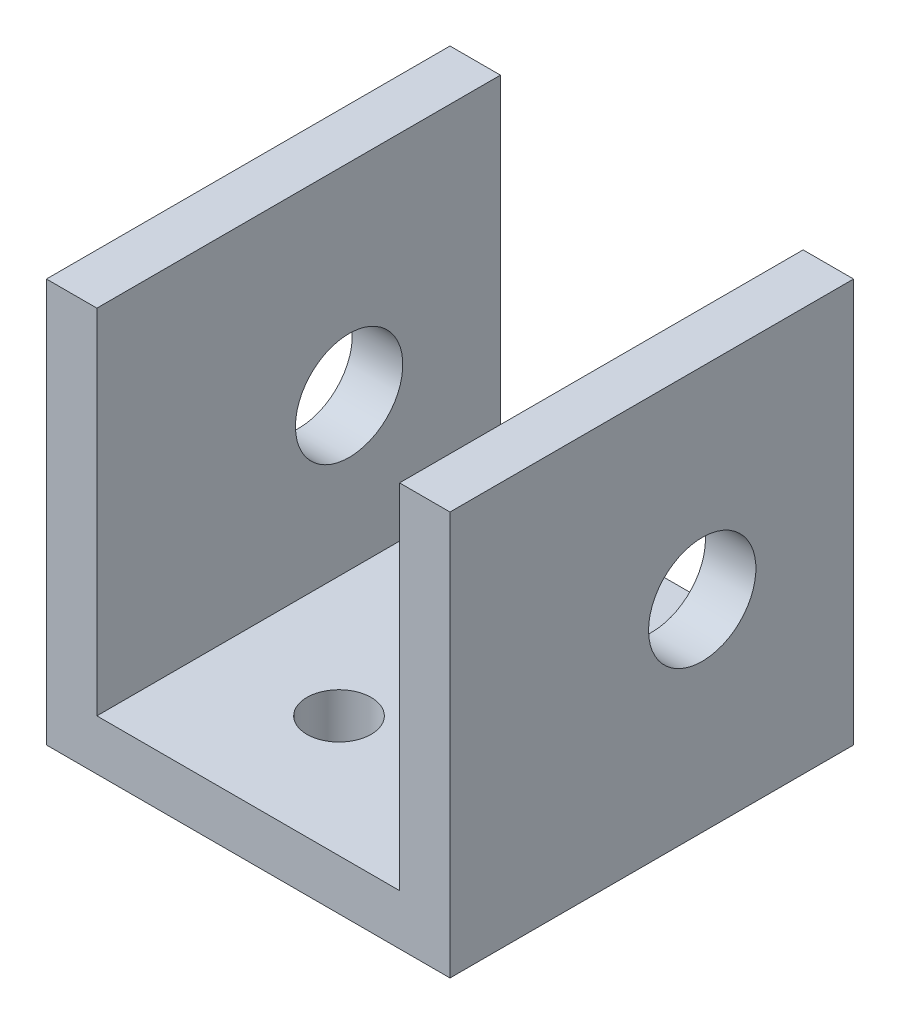
from build123d import *

# Parameters (mm, degrees)
SKETCH1_W               = 25.4
SKETCH1_H               = 25.4
BOSS_EXTRUDE1_DEPTH     = 3.175
SKETCH2_W               = 3.175
SKETCH2_H               = 25.4
BOSS_EXTRUDE2_DEPTH     = 22.225
F_10_32_TAPPED_HOLE1_D  = 4.0386
F_1_4_CLEARANCE_HOLE1_D = 6.7564


with BuildPart() as part:
    # Sketch1 → Boss-Extrude1 (new body)
    with BuildSketch(Plane(origin=(0, 0, 0), x_dir=(1, 0, 0), z_dir=(0, 1, 0))):
        Rectangle(SKETCH1_W, SKETCH1_H)
    extrude(amount=BOSS_EXTRUDE1_DEPTH)

    # Sketch2 → Boss-Extrude2 (add)
    with BuildSketch(Plane(origin=(0, 3.175, 0), x_dir=(1, 0, 0), z_dir=(0, 1, 0))):
        with Locations((-11.1125, 0)):
            Rectangle(SKETCH2_W, SKETCH2_H)
        with Locations((11.1125, 0)):
            Rectangle(SKETCH2_W, SKETCH2_H)
    extrude(amount=BOSS_EXTRUDE2_DEPTH)

    # #10-32 Tapped Hole1 (through all)
    with Locations(Plane(origin=(0, 3.175, 0), x_dir=(1, 0, 0), z_dir=(0, 1, 0))):
        with Locations((1.905, 5.08), (-1.905, -5.08)):
            Hole(F_10_32_TAPPED_HOLE1_D / 2)

    # 1/4 Clearance Hole1 (through all)
    with Locations(Plane.ZY.offset(12.7)):
        with Locations((-3.175, 12.7)):
            Hole(F_1_4_CLEARANCE_HOLE1_D / 2)


solid = part.part
